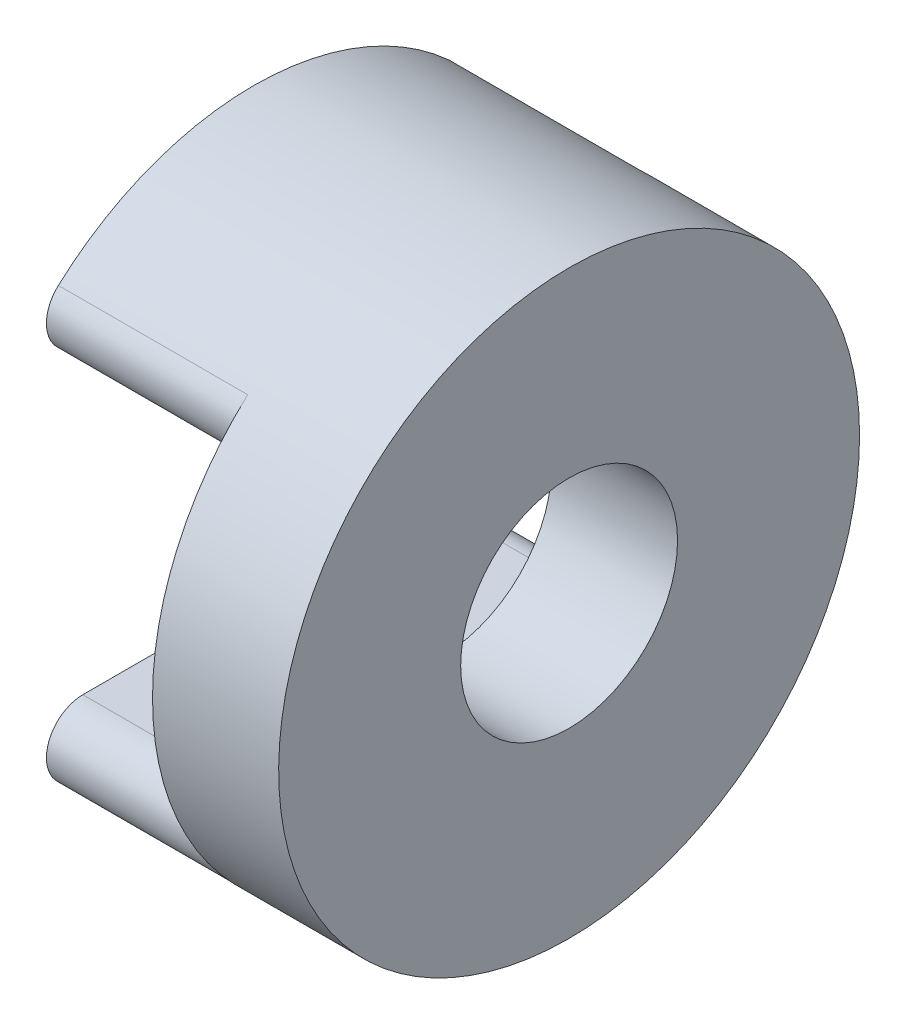
from build123d import *

# Parameters (mm, degrees)
SKETCH1_R               = 23.9375
SKETCH1_R_2             = 8.9375
BOSS_EXTRUDE1_DEPTH     = 26
CUT_EXTRUDE1_DEPTH      = 43.684983454
CUT_EXTRUDE1_DEPTH_BACK = 43.684983454
SKETCH2_W               = 15.604259589
SKETCH2_H               = 25
FILLET1_R               = 3


with BuildPart() as part:
    # Sketch1 → Boss-Extrude1 (new body)
    with BuildSketch(Plane(origin=(0, 0, 0), x_dir=(0, 0, -1), z_dir=(1, 0, 0))):
        Circle(SKETCH1_R)
        Circle(SKETCH1_R_2, mode=Mode.SUBTRACT)
    extrude(amount=BOSS_EXTRUDE1_DEPTH)

    # Sketch2 → Cut-Extrude1 (cut, two sides: drawn at the far end of the back side and taken through both)
    with BuildSketch(Plane.XY.offset(-CUT_EXTRUDE1_DEPTH_BACK)):
        with Locations((7.802129795, 0)):
            Rectangle(SKETCH2_W, SKETCH2_H)
    extrude(amount=CUT_EXTRUDE1_DEPTH + CUT_EXTRUDE1_DEPTH_BACK, mode=Mode.SUBTRACT)

    # Fillet1
    fillet1_edges = [part.edges().sort_by_distance(p)[0] for p in [
        (7.802129795, 12.5, 20.414551336),
        (7.802129795, -12.5, 20.414551336),
        (7.802129795, -12.5, -20.414551336),
        (7.802129795, 12.5, -20.414551336),
    ]]
    fillet(fillet1_edges, radius=FILLET1_R)


solid = part.part
